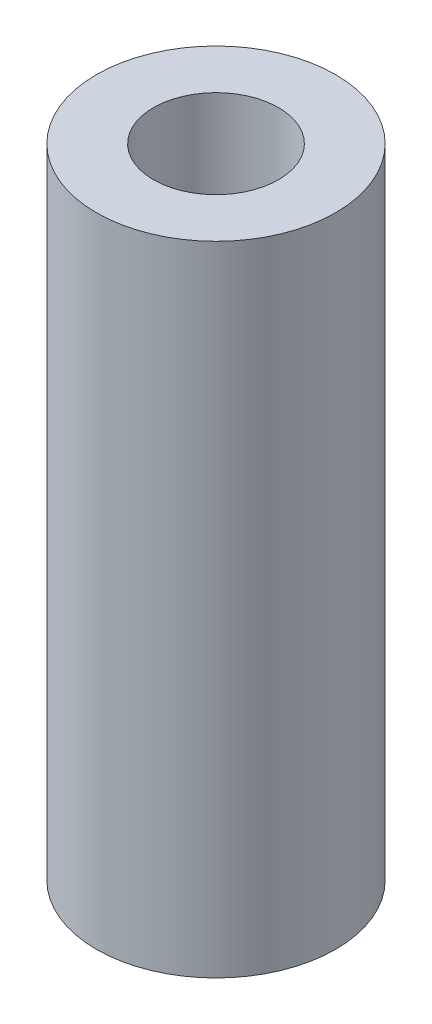
from build123d import *

# Parameters (mm, degrees)
SKETCH1_R           = 4.7625
SKETCH1_R_2         = 2.4892
BOSS_EXTRUDE1_DEPTH = 12.7


with BuildPart() as part:
    # Sketch1 → Boss-Extrude1 (new, symmetric)
    with BuildSketch(Plane(origin=(0, 0, 0), x_dir=(1, 0, 0), z_dir=(0, 1, 0))):
        Circle(SKETCH1_R)
        Circle(SKETCH1_R_2, mode=Mode.SUBTRACT)
    extrude(amount=BOSS_EXTRUDE1_DEPTH, both=True)


solid = part.part
